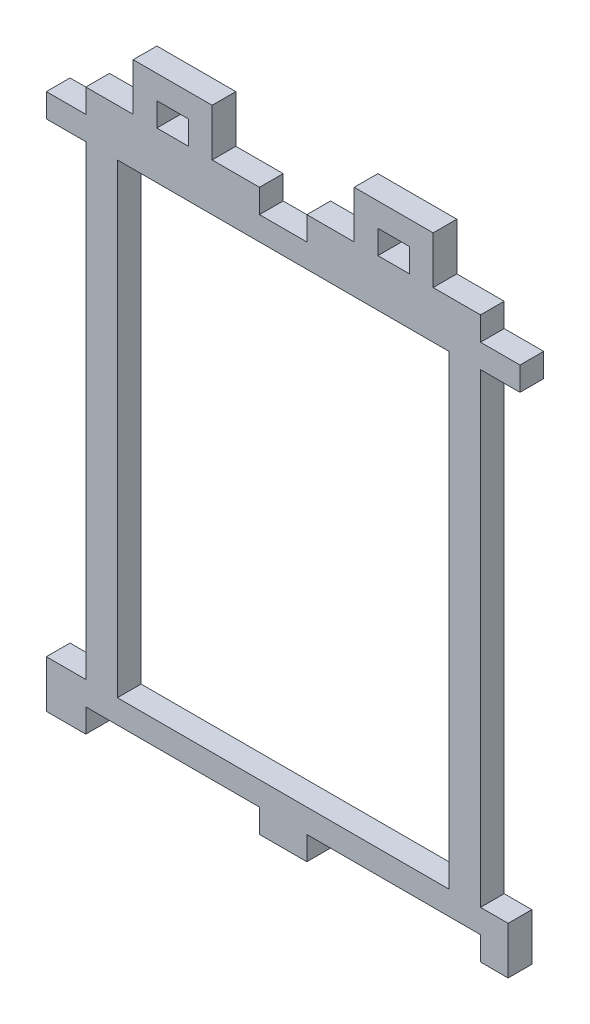
from build123d import *

# Parameters (mm, degrees)
SKETCH1_W           = 42
SKETCH1_H           = 59
BOSS_EXTRUDE1_DEPTH = 3
BOSS_EXTRUDE2_DEPTH = 3


with BuildPart() as part:
    # Sketch1 → Boss-Extrude1 (new body)
    with BuildSketch(Plane.XY):
        Polygon((0, 0), (5, 0), (5, 3), (27, 3), (27, 0), (33, 0), (33, 3), (55, 3), (55, 0), (60, 0), (60, -3), (55, -3), (55, -62), (58.5, -62), (58.5, -68), (55, -68), (55, -65), (33, -65), (33, -68), (27, -68), (27, -65), (5, -65), (5, -68), (0, -68), (0, -62), (5, -62), (5, -3), (0, -3), align=None)
        with Locations((30, -32.5)):
            Rectangle(SKETCH1_W, SKETCH1_H, mode=Mode.SUBTRACT)
    extrude(amount=BOSS_EXTRUDE1_DEPTH)

    # Sketch2 → Boss-Extrude2 (add)
    with BuildSketch(Plane(origin=(0, 0, 0), x_dir=(-1, 0, 0), z_dir=(0, 0, -1))):
        Polygon((-49, 9), (-49, 3), (-46, 3), (-46, 6), (-42, 6), (-42, 3), (-39, 3), (-39, 9), align=None)
        Polygon((-21, 3), (-18, 3), (-18, 6), (-14, 6), (-14, 3), (-11, 3), (-11, 9), (-21, 9), align=None)
    extrude(amount=-BOSS_EXTRUDE2_DEPTH)


solid = part.part
